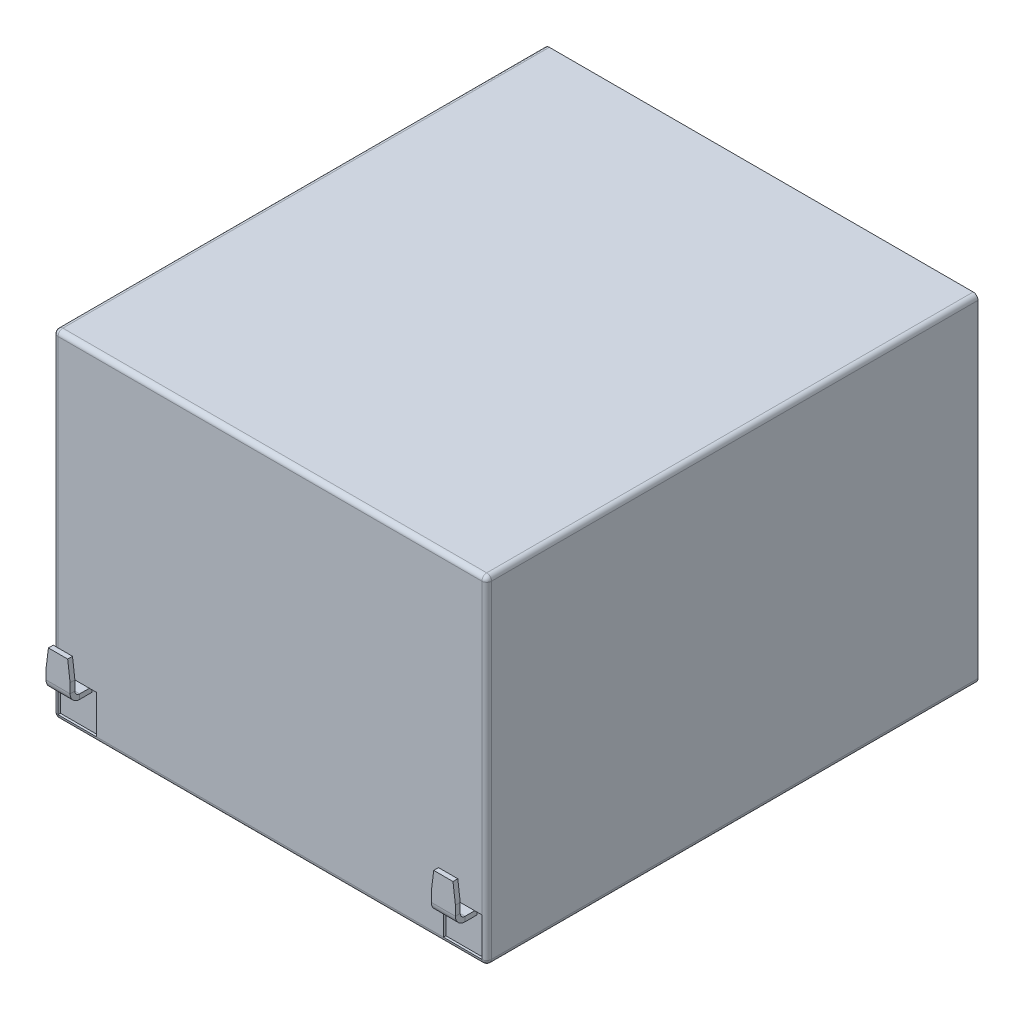
from build123d import *

# Parameters (mm, degrees)
SKETCH_1_W             = 90
SKETCH_1_H             = 70
EXTRUDE_1_DEPTH        = 102
SKETCH_2_W             = 8
SKETCH_2_H             = 8
CUT_EXTRUDE_1_DEPTH    = 0.5
FILLET_1_R             = 1
SM_BASE_FLANGE_1_DEPTH = 5
CHAMFER_1_SIZE         = 0.5
CHAMFER_1_SIZE2        = 4
CHAMFER_2_SIZE         = 4
CHAMFER_2_SIZE2        = 0.5


with BuildPart() as part:
    # Sketch 1 → 填料-伸長1 (new body)
    with BuildSketch(Plane.XY):
        Rectangle(SKETCH_1_W, SKETCH_1_H)
    extrude(amount=EXTRUDE_1_DEPTH)

    # Sketch 2 → 除料-伸長1 (cut)
    with BuildSketch(Plane.XY.offset(102)):
        with Locations((-40, -30)):
            Rectangle(SKETCH_2_W, SKETCH_2_H)
    cut_extrude_1 = extrude(amount=-CUT_EXTRUDE_1_DEPTH, mode=Mode.SUBTRACT)

    # 鏡射1: 除料-伸長1 across plane
    add(cut_extrude_1.mirror(Plane(origin=(0, 0, 0), x_dir=(0, 0, 1), z_dir=(1, 0, 0))), mode=Mode.SUBTRACT)

    # 圓角1
    fillet_1_edges = [part.edges().sort_by_distance(p)[0] for p in [
        (-45, 0, 102),
        (0, -35, 102),
        (45, 0, 102),
        (0, 35, 102),
        (45, -35, 51),
        (-45, -35, 51),
        (-45, 35, 51),
        (45, 35, 51),
    ]]
    fillet(fillet_1_edges, radius=FILLET_1_R - 0.0001)  # a hair under: the kernel refuses the full size


with BuildPart() as body_2:
    # 基材-凸緣1: sheet metal written as solids
    # 草圖4 → 基材-凸緣1 (new body)
    with BuildSketch(Plane.ZY.offset(37.5)):
        with BuildLine():
            Line((101.5, -26), (104, -26))
            ThreePointArc((104, -26), (104.707106781, -25.707106781), (105, -25))
            Line((105, -25), (105, -19))
            Line((105, -19), (106, -19))
            Line((106, -19), (106, -25))
            ThreePointArc((106, -25), (105.414213562, -26.414213562), (104, -27))
            Line((104, -27), (101.5, -27))
            Line((101.5, -27), (101.5, -26))
        make_face()
    extrude(amount=SM_BASE_FLANGE_1_DEPTH)

    # 導角1
    chamfer_1_edges = [body_2.edges().sort_by_distance(p)[0] for p in [
        (-37.5, -19, 105.5),
    ]]
    chamfer_1_side = [body_2.faces().sort_by_distance(p)[0] for p in [
        (-40, -19, 105.5),
    ]]
    chamfer(chamfer_1_edges, length=CHAMFER_1_SIZE, length2=CHAMFER_1_SIZE2, reference=chamfer_1_side[0])

    # 導角2
    chamfer_2_edges = [body_2.edges().sort_by_distance(p)[0] for p in [
        (-42.5, -19, 105.5),
    ]]
    chamfer_2_side = [body_2.faces().sort_by_distance(p)[0] for p in [
        (-42.5, -26.908212201, 102.75),
    ]]
    chamfer(chamfer_2_edges, length=CHAMFER_2_SIZE, length2=CHAMFER_2_SIZE2, reference=chamfer_2_side[0])


with BuildPart() as body_3:
    # 鏡射2: read off the stored shape, not the designer's step
    # 鏡射2: mirrored copy
    add(body_2.part.mirror(Plane.YZ))


solid = Compound([part.part, body_2.part, body_3.part])
